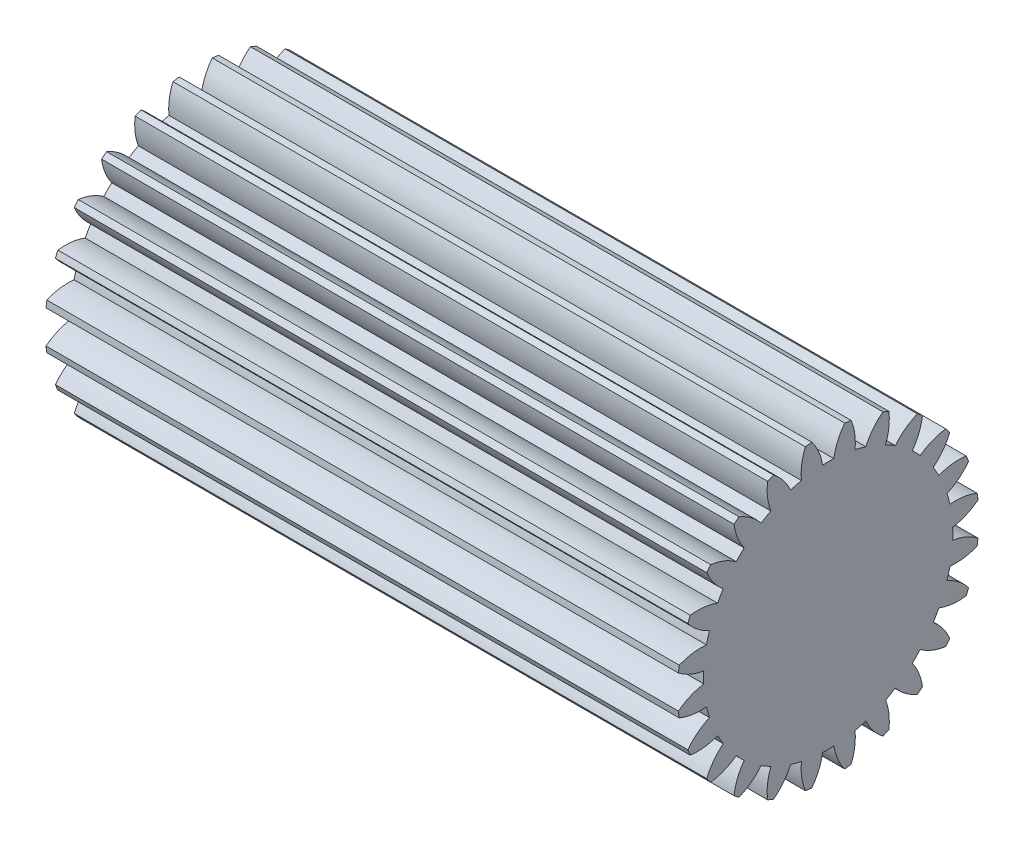
from build123d import *

# Parameters (mm, degrees)
BASPROSKE_W     = 54.565
BASPROSKE_H     = 13
TOOTHCUT_DEPTH  = 58.578982494
TEETHCUTS_COUNT = 24
TEETHCUTS_ANGLE = 345
BORSKE_R        = 0.4
BORE_DEPTH      = 50.0000508
SCALE1_SCALE    = 2


with BuildPart() as part:
    # BasProSke → Base-Revolve (revolve)
    with BuildSketch(Plane(origin=(0, 0, 0), x_dir=(1, 0, 0), z_dir=(0, 1, 0))):
        with Locations((27.2825, 6.5)):
            Rectangle(BASPROSKE_W, BASPROSKE_H)
    revolve(axis=Axis((-10, 0, 0), (1, 0, 0)))

    # TooCutSke → ToothCut (cut, through all)
    with BuildSketch(Plane(origin=(0, 0, 0), x_dir=(0, 0, -1), z_dir=(1, 0, 0))):
        with BuildLine():
            ThreePointArc((0.483448384, 10.738122679), (0, 10.749), (-0.483448384, 10.738122679))
            ThreePointArc((-0.483448384, 10.738122679), (-0.821636462, 11.902754369), (-1.44092227, 12.945454344))
            ThreePointArc((-1.44092227, 12.945454344), (0, 13.0254), (1.44092227, 12.945454344))
            ThreePointArc((1.44092227, 12.945454344), (0.821636462, 11.902754369), (0.483448384, 10.738122679))
        make_face()
    toothcut = extrude(amount=TOOTHCUT_DEPTH, mode=Mode.SUBTRACT)

    # TeethCuts: ToothCut ×24 about axis
    teethcuts_axis = Axis((-10, 0, 0), (1, 0, 0))
    for i in range(1, TEETHCUTS_COUNT):
        add(toothcut.rotate(teethcuts_axis, i * TEETHCUTS_ANGLE / (TEETHCUTS_COUNT - 1)), mode=Mode.SUBTRACT)

    # BorSke → Bore (cut, symmetric)
    with BuildSketch(Plane(origin=(0, 0, 0), x_dir=(0, 0, -1), z_dir=(1, 0, 0))):
        Circle(BORSKE_R)
    extrude(amount=BORE_DEPTH, both=True, mode=Mode.SUBTRACT)


with BuildPart() as part_1:
    # Scale1: scaled about (27.284897052, 0, 0)
    add(part.part.scale(SCALE1_SCALE).moved(Location((-27.284897052, 0, 0))))


solid = part_1.part
